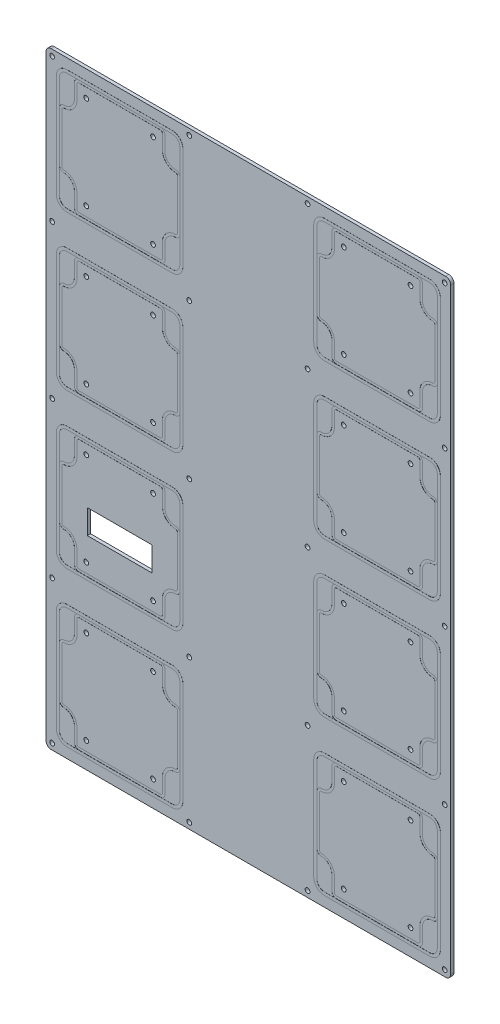
from build123d import *

# Parameters (mm, degrees)
SKETCH1_W            = 254
SKETCH1_H            = 381
BOSS_EXTRUDE1_DEPTH  = 2.032
SKETCH2_R            = 1.4732
CUT_EXTRUDE1_DEPTH   = 458.909520565
FILLET1_R            = 3.175
CUT_EXTRUDE2_DEPTH   = 0.0508
BOSS_EXTRUDE2_DEPTH  = 0.0508
SKETCH5_R            = 1.4732
CUT_EXTRUDE3_DEPTH   = 458.909520565
LPATTERN1_COUNT      = 4
LPATTERN1_PITCH      = 96.8756
LPATTERN1_COUNT_DIR2 = 2
LPATTERN1_PITCH_DIR2 = 161.5948
SKETCH6_W            = 40.64
SKETCH6_H            = 15.24
CUT_EXTRUDE4_DEPTH   = 458.909520565


with BuildPart() as part:
    # Sketch1 → Boss-Extrude1 (new body)
    with BuildSketch(Plane.XY):
        with Locations((127, 190.5)):
            Rectangle(SKETCH1_W, SKETCH1_H)
    extrude(amount=BOSS_EXTRUDE1_DEPTH)

    # Sketch2 → Cut-Extrude1 (cut, through all)
    with BuildSketch(Plane.XY.offset(2.032)):
        with Locations((3.81, 377.19)):
            Circle(SKETCH2_R)
        with Locations((89.8652, 377.19)):
            Circle(SKETCH2_R)
        with Locations((164.1348, 377.19)):
            Circle(SKETCH2_R)
        with Locations((250.19, 377.19)):
            Circle(SKETCH2_R)
        with Locations((164.1348, 287.375451288)):
            Circle(SKETCH2_R)
        with Locations((3.81, 287.3756)):
            Circle(SKETCH2_R)
        with Locations((250.19, 287.3756)):
            Circle(SKETCH2_R)
        with Locations((89.8652, 287.3756)):
            Circle(SKETCH2_R)
        with Locations((164.1348, 190.499990436)):
            Circle(SKETCH2_R)
        with Locations((3.81, 191.135)):
            Circle(SKETCH2_R)
        with Locations((250.19, 190.5)):
            Circle(SKETCH2_R)
        with Locations((89.8652, 190.5)):
            Circle(SKETCH2_R)
        with Locations((164.1348, 93.6244)):
            Circle(SKETCH2_R)
        with Locations((3.81, 93.6244)):
            Circle(SKETCH2_R)
        with Locations((250.19, 93.6244)):
            Circle(SKETCH2_R)
        with Locations((89.8652, 93.6244)):
            Circle(SKETCH2_R)
        with Locations((164.1348, 3.81)):
            Circle(SKETCH2_R)
        with Locations((3.81, 3.81)):
            Circle(SKETCH2_R)
        with Locations((250.19, 3.81)):
            Circle(SKETCH2_R)
        with Locations((89.8652, 3.81)):
            Circle(SKETCH2_R)
    extrude(amount=-CUT_EXTRUDE1_DEPTH, mode=Mode.SUBTRACT)

    # Fillet1
    fillet1_edges = [part.edges().sort_by_distance(p)[0] for p in [
        (254, 0, 1.016),
        (0, 0, 1.016),
        (254, 381, 1.016),
        (0, 381, 1.016),
    ]]
    fillet(fillet1_edges, radius=FILLET1_R)

    # Sketch3 → Cut-Extrude2 (cut)
    with BuildSketch(Plane.XY.offset(2.032)):
        with BuildLine():
            Line((17.78, 79.1718), (17.78, 70.1802))
            ThreePointArc((17.78, 70.1802), (15.853172671, 65.528427329), (11.2014, 63.6016))
            ThreePointArc((11.2014, 63.6016), (9.207783141, 62.775816859), (8.382, 60.7822))
            Line((8.382, 60.7822), (8.382, 29.591))
            ThreePointArc((8.382, 29.591), (9.207783141, 27.597383141), (11.2014, 26.7716))
            ThreePointArc((11.2014, 26.7716), (15.853172671, 24.844772671), (17.78, 20.193))
            Line((17.78, 20.193), (17.78, 11.2014))
            ThreePointArc((17.78, 11.2014), (18.605783141, 9.207783141), (20.5994, 8.382))
            Line((20.5994, 8.382), (71.8058, 8.382))
            ThreePointArc((71.8058, 8.382), (73.799416859, 9.207783141), (74.6252, 11.2014))
            Line((74.6252, 11.2014), (74.6252, 20.193))
            ThreePointArc((74.6252, 20.193), (76.552027329, 24.844772671), (81.2038, 26.7716))
            ThreePointArc((81.2038, 26.7716), (83.197416859, 27.597383141), (84.0232, 29.591))
            Line((84.0232, 29.591), (84.0232, 60.7822))
            ThreePointArc((84.0232, 60.7822), (83.197416859, 62.775816859), (81.2038, 63.6016))
            ThreePointArc((81.2038, 63.6016), (76.552027329, 65.528427329), (74.6252, 70.1802))
            Line((74.6252, 70.1802), (74.6252, 79.1718))
            ThreePointArc((74.6252, 79.1718), (73.799416859, 81.165416859), (71.8058, 81.9912))
            Line((71.8058, 81.9912), (20.5994, 81.9912))
            ThreePointArc((20.5994, 81.9912), (18.605783141, 81.165416859), (17.78, 79.1718))
        make_face()
        with BuildLine():
            Line((82.4357, 29.591), (82.4357, 60.7822))
            ThreePointArc((82.4357, 60.7822), (82.074884844, 61.653284844), (81.2038, 62.0141))
            ThreePointArc((81.2038, 62.0141), (75.429495314, 64.405895314), (73.0377, 70.1802))
            Line((73.0377, 70.1802), (73.0377, 79.1718))
            ThreePointArc((73.0377, 79.1718), (72.676884844, 80.042884844), (71.8058, 80.4037))
            Line((71.8058, 80.4037), (20.5994, 80.4037))
            ThreePointArc((20.5994, 80.4037), (19.728315156, 80.042884844), (19.3675, 79.1718))
            Line((19.3675, 79.1718), (19.3675, 70.1802))
            ThreePointArc((19.3675, 70.1802), (16.975704686, 64.405895314), (11.2014, 62.0141))
            ThreePointArc((11.2014, 62.0141), (10.330315156, 61.653284844), (9.9695, 60.7822))
            Line((9.9695, 60.7822), (9.9695, 29.591))
            ThreePointArc((9.9695, 29.591), (10.330315156, 28.719915156), (11.2014, 28.3591))
            ThreePointArc((11.2014, 28.3591), (16.975704686, 25.967304686), (19.3675, 20.193))
            Line((19.3675, 20.193), (19.3675, 11.2014))
            ThreePointArc((19.3675, 11.2014), (19.728315156, 10.330315156), (20.5994, 9.9695))
            Line((20.5994, 9.9695), (71.8058, 9.9695))
            ThreePointArc((71.8058, 9.9695), (72.676884844, 10.330315156), (73.0377, 11.2014))
            Line((73.0377, 11.2014), (73.0377, 20.193))
            ThreePointArc((73.0377, 20.193), (75.429495314, 25.967304686), (81.2038, 28.3591))
            ThreePointArc((81.2038, 28.3591), (82.074884844, 28.719915156), (82.4357, 29.591))
        make_face(mode=Mode.SUBTRACT)
    cut_extrude2 = extrude(amount=-CUT_EXTRUDE2_DEPTH, mode=Mode.SUBTRACT)

    # Sketch4 → Boss-Extrude2 (add)
    with BuildSketch(Plane.XY.offset(2.032)):
        with BuildLine():
            Line((6.477, 60.7822), (6.477, 77.2287))
            ThreePointArc((6.477, 77.2287), (8.429865536, 81.943334464), (13.1445, 83.8962))
            Line((13.1445, 83.8962), (20.5994, 83.8962))
            Line((20.5994, 83.8962), (79.2607, 83.8962))
            ThreePointArc((79.2607, 83.8962), (83.975334464, 81.943334464), (85.9282, 77.2287))
            Line((85.9282, 77.2287), (85.9282, 13.1445))
            ThreePointArc((85.9282, 13.1445), (83.975334464, 8.429865536), (79.2607, 6.477))
            Line((79.2607, 6.477), (13.1445, 6.477))
            ThreePointArc((13.1445, 6.477), (8.429865536, 8.429865536), (6.477, 13.1445))
            Line((6.477, 13.1445), (6.477, 60.7822))
        make_face()
        with BuildLine():
            Line((8.382, 60.7822), (8.382, 77.2287))
            ThreePointArc((8.382, 77.2287), (9.776903955, 80.596296045), (13.1445, 81.9912))
            Line((13.1445, 81.9912), (20.5994, 81.9912))
            Line((20.5994, 81.9912), (79.2607, 81.9912))
            ThreePointArc((79.2607, 81.9912), (82.628296045, 80.596296045), (84.0232, 77.2287))
            Line((84.0232, 77.2287), (84.0232, 13.1445))
            ThreePointArc((84.0232, 13.1445), (82.628296045, 9.776903955), (79.2607, 8.382))
            Line((79.2607, 8.382), (13.1445, 8.382))
            ThreePointArc((13.1445, 8.382), (9.776903955, 9.776903955), (8.382, 13.1445))
            Line((8.382, 13.1445), (8.382, 60.7822))
        make_face(mode=Mode.SUBTRACT)
    boss_extrude2 = extrude(amount=BOSS_EXTRUDE2_DEPTH)

    # Sketch5 → Cut-Extrude3 (cut, through all)
    with BuildSketch(Plane.XY.offset(2.032)):
        with Locations((25.2476, 74.3966)):
            Circle(SKETCH5_R)
        with Locations((67.1576, 74.3966)):
            Circle(SKETCH5_R)
        with Locations((67.1576, 15.9766)):
            Circle(SKETCH5_R)
        with Locations((25.2476, 15.9766)):
            Circle(SKETCH5_R)
    cut_extrude3 = extrude(amount=-CUT_EXTRUDE3_DEPTH, mode=Mode.SUBTRACT)

    # LPattern1: Cut-Extrude2, Boss-Extrude2, Cut-Extrude3 4 × 2
    with Locations(*[(j * LPATTERN1_PITCH_DIR2, i * LPATTERN1_PITCH, 0) for i in range(LPATTERN1_COUNT) for j in range(LPATTERN1_COUNT_DIR2) if (i, j) != (0, 0)]):
        add(cut_extrude2, mode=Mode.SUBTRACT)
        add(boss_extrude2)
        add(cut_extrude3, mode=Mode.SUBTRACT)

    # Sketch6 → Cut-Extrude4 (cut, through all)
    with BuildSketch(Plane.XY.offset(2.032)):
        with Locations((46.2026, 135.255)):
            Rectangle(SKETCH6_W, SKETCH6_H)
    extrude(amount=-CUT_EXTRUDE4_DEPTH, mode=Mode.SUBTRACT)


solid = part.part
